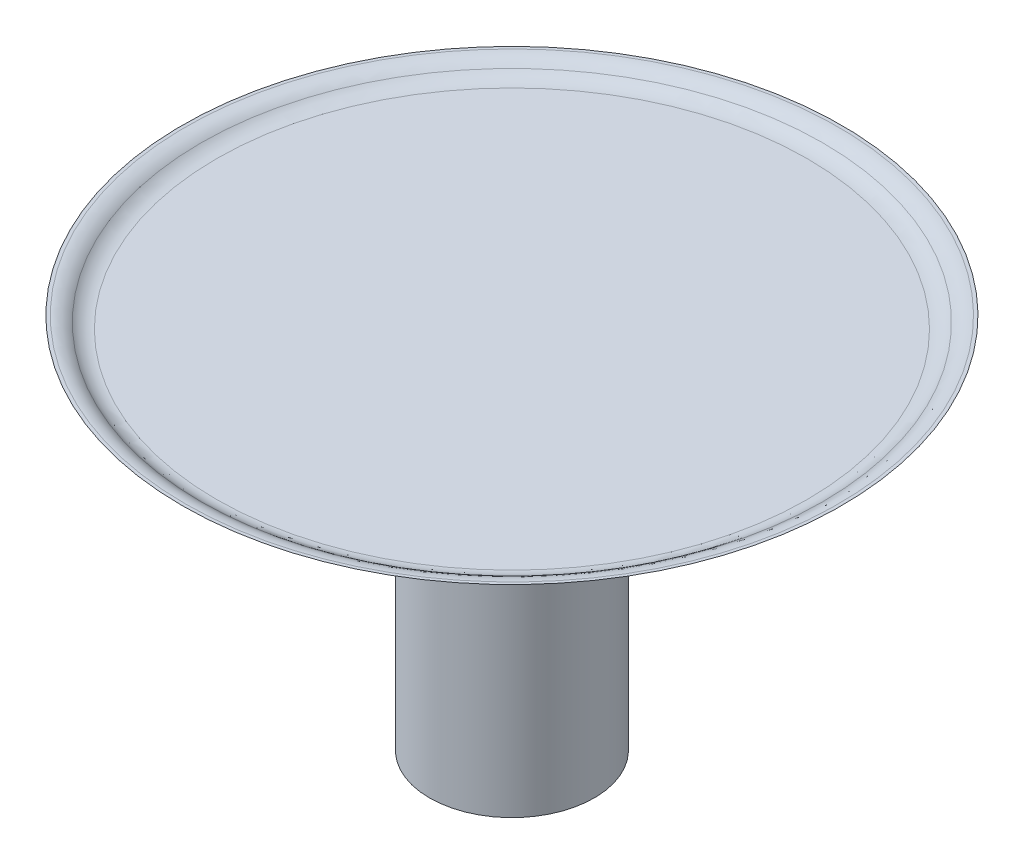
from build123d import *

# Parameters (mm, degrees)
SKETCH1_R           = 3.5
BOSS_EXTRUDE1_DEPTH = 10
SKETCH2_R           = 2.5
BOSS_EXTRUDE2_DEPTH = 2
SKETCH3_R           = 3.5
BOSS_EXTRUDE3_DEPTH = 2
SKETCH4_R           = 14
BOSS_EXTRUDE4_DEPTH = 2
FILLET1_R           = 10
SKETCH5_R           = 13
CUT_EXTRUDE1_DEPTH  = 0.5
FILLET2_R           = 1
FILLET3_R           = 1


with BuildPart() as part:
    # Sketch1 → Boss-Extrude1 (new body)
    with BuildSketch(Plane(origin=(0, 0, 0), x_dir=(1, 0, 0), z_dir=(0, 1, 0))):
        with Locations(Location((0, 0, 0), (0, 0, 270))):
            Circle(SKETCH1_R)
    extrude(amount=BOSS_EXTRUDE1_DEPTH)

    # Sketch2 → Boss-Extrude2 (add)
    with BuildSketch(Plane(origin=(0, 10, 0), x_dir=(1, 0, 0), z_dir=(0, 1, 0))):
        with Locations(Location((0, 0, 0), (0, 0, 270))):
            Circle(SKETCH2_R)
    extrude(amount=BOSS_EXTRUDE2_DEPTH)

    # Sketch3 → Boss-Extrude3 (add)
    with BuildSketch(Plane(origin=(0, 12, 0), x_dir=(1, 0, 0), z_dir=(0, 1, 0))):
        with Locations(Location((0, 0, 0), (0, 0, 270))):
            Circle(SKETCH3_R)
    extrude(amount=BOSS_EXTRUDE3_DEPTH)

    # Sketch4 → Boss-Extrude4 (add)
    with BuildSketch(Plane(origin=(0, 14, 0), x_dir=(1, 0, 0), z_dir=(0, 1, 0))):
        with Locations(Location((0, 0, 0), (0, 0, 270))):
            Circle(SKETCH4_R)
    extrude(amount=BOSS_EXTRUDE4_DEPTH)

    # Fillet1
    # the kernel refuses this fillet: 10 mm, written as the material it takes off along each edge
    with BuildSketch(Plane(origin=(0, 14, 0), x_dir=(0, 0, 1), z_dir=(-1, 0, 0))) as fillet1_piece_1:
        with BuildLine():
            CenterArc((8, 10), FILLET1_R, 270, 36.869897646)
            Line((8, 0), (8, -0.2))
            Line((8, -0.2), (14, -0.2))
            Line((14, -0.2), (14.2, 0))
            ThreePointArc((14.2, 0), (14.2, 1), (14.12, 1.84))
            Line((14.12, 1.84), (14, 2))
        make_face()
    revolve(axis=Axis((0, 14, 0), (0, 1, 0)), mode=Mode.SUBTRACT)

    # Sketch5 → Cut-Extrude1 (cut)
    with BuildSketch(Plane(origin=(0, 16, 0), x_dir=(1, 0, 0), z_dir=(0, 1, 0))):
        with Locations(Location((0, 0, 0), (0, 0, 270))):
            Circle(SKETCH5_R)
    extrude(amount=-CUT_EXTRUDE1_DEPTH, mode=Mode.SUBTRACT)

    # Fillet2
    # the kernel refuses this fillet: 1 mm, written as the material it takes off along each edge
    with BuildSketch(Plane(origin=(0, 16, 0), x_dir=(0, 0, 1), z_dir=(-1, 0, 0))) as fillet2_piece_1:
        with BuildLine():
            CenterArc((13.866025404, -1), FILLET2_R, 90, 60)
            Line((13, -0.5), (12.982679492, -0.49))
            ThreePointArc((12.982679492, -0.49), (12.98, -0.25), (12.98, 0))
            Line((12.98, 0), (13, 0.02))
            Line((13, 0.02), (13.866025404, 0.02))
            Line((13.866025404, 0.02), (13.866025404, 0))
        make_face()
    revolve(axis=Axis((0, 16, 0), (0, 1, 0)), mode=Mode.SUBTRACT)

    # Fillet3
    fillet3_edges = [part.edges().sort_by_distance(p)[0] for p in [
        (0, 15.5, -13),
    ]]
    fillet(fillet3_edges, radius=FILLET3_R)


solid = part.part
